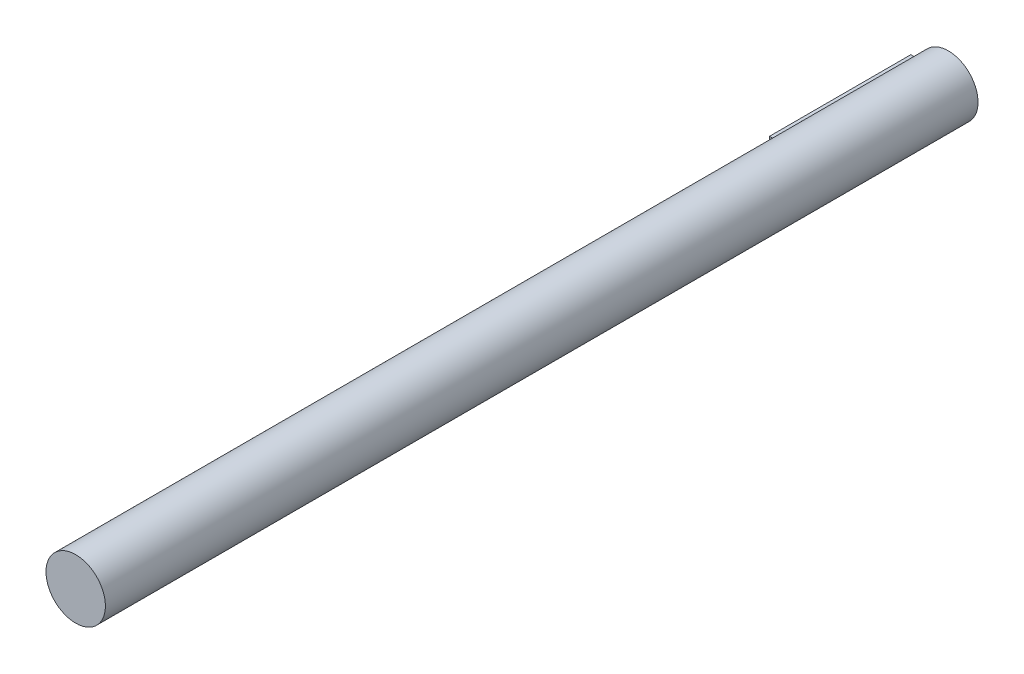
from build123d import *

# Parameters (mm, degrees)
BOSS_EXTRUDE4_DEPTH = 58.928
SKETCH8_R           = 12.3825
BOSS_EXTRUDE5_DEPTH = 304.8


with BuildPart() as part:
    # Sketch1 → Boss-Extrude4 (new body)
    with BuildSketch(Plane.XY):
        with BuildLine():
            Line((-11.968528784, 3.175), (-15.621, 3.175))
            Line((-15.621, 3.175), (-15.621, -2.921))
            Line((-15.621, -2.921), (-12.033040565, -2.921))
            ThreePointArc((-12.033040565, -2.921), (12.381806686, -0.131032219), (-11.968528784, 3.175))
        make_face()
    extrude(amount=BOSS_EXTRUDE4_DEPTH)

    # Sketch8 → Boss-Extrude5 (add)
    with BuildSketch(Plane.XY.offset(58.928)):
        Circle(SKETCH8_R)
    extrude(amount=BOSS_EXTRUDE5_DEPTH)


solid = part.part
